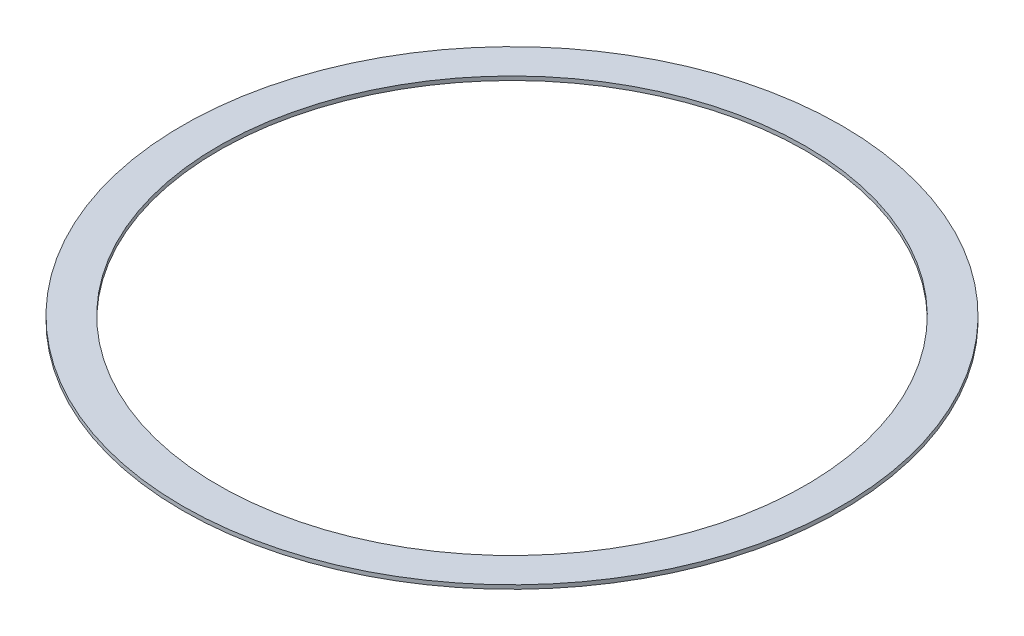
from build123d import *

# Parameters (mm, degrees)
SKETCH1_R           = 64.135
SKETCH1_R_2         = 57.15
BOSS_EXTRUDE1_DEPTH = 0.762


with BuildPart() as part:
    # Sketch1 → Boss-Extrude1 (new body)
    with BuildSketch(Plane(origin=(0, 0, 0), x_dir=(1, 0, 0), z_dir=(0, 1, 0))):
        Circle(SKETCH1_R)
        Circle(SKETCH1_R_2, mode=Mode.SUBTRACT)
    extrude(amount=BOSS_EXTRUDE1_DEPTH)


solid = part.part
